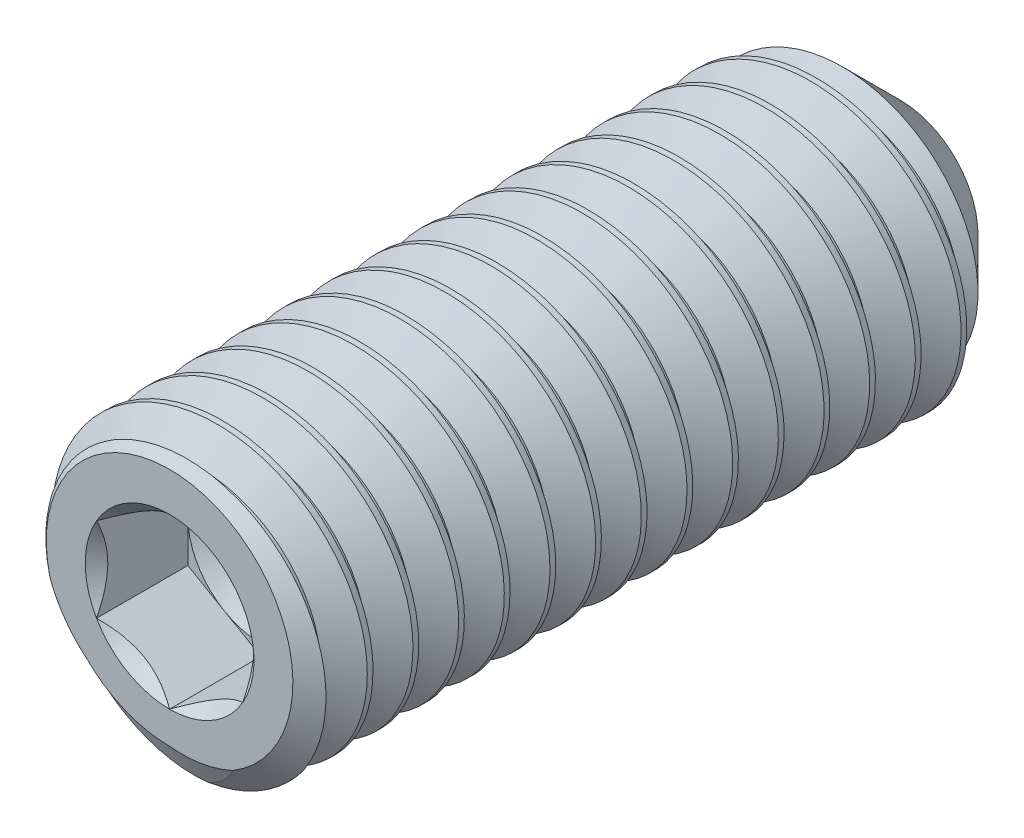
from build123d import *

# Parameters (mm, degrees)
CUT_EXTRUDE1_DEPTH = 2.5
CUT_SWEEP1_PITCH   = 1.25


with BuildPart() as part:
    # Sketch11 → Revolve1 (revolve)
    with BuildSketch(Plane(origin=(0, 0, 0), x_dir=(0, 0, -1), z_dir=(1, 0, 0)), mode=Mode.PRIVATE) as revolve1_sk:
        Polygon((-10, 0), (-10, 3.375), (-9.562370289, 4), (8.125, 4), (10, 2.125), (8.723171185, 0), align=None)
    revolve(revolve1_sk.sketch.rotate(Axis((0, 0, -8.723171185), (0, 0, -1)), 180), axis=Axis((0, 0, -8.723171185), (0, 0, -1)))

    # Sketch2 → Cut-Extrude1 (cut)
    with BuildSketch(Plane.XY.offset(10)):
        Polygon((0, 2.309401077), (-2, 1.154700538), (-2, -1.154700538), (0, -2.309401077), (2, -1.154700538), (2, 1.154700538), align=None)
    extrude(amount=-CUT_EXTRUDE1_DEPTH, mode=Mode.SUBTRACT)

    # Cut-Extrude2 cone 1 section (through the dimple's axis) → Cut-Extrude2 (revolve, cut)
    with BuildSketch(Plane(origin=(0, 0, 10), x_dir=(0, -1, 0), z_dir=(1, 0, 0))):
        Polygon((0, 0), (2.309401077, 0), (0, 2.309401077), align=None)
    revolve(axis=Axis((0, 0, 10), (0, 0, -1)), mode=Mode.SUBTRACT)

    # Cut-Extrude3 cone 1 section (through the dimple's axis) → Cut-Extrude3 (revolve, cut)
    with BuildSketch(Plane(origin=(0, 0, 7.5), x_dir=(0, -1, 0), z_dir=(1, 0, 0))):
        Polygon((0, 0), (2, 0), (0, 1.154700538), align=None)
    revolve(axis=Axis((0, 0, 7.5), (0, 0, -1)), mode=Mode.SUBTRACT)

    # Cut-Sweep1: the profile of Sketch6 screwed along a right-hand helix of 17.6 turns, 8 arcs to a turn; built about Z, then put on its axis
    cut_sweep1_z = Axis((0, 0, 0), (0, 0, 1))
    cut_sweep1_corners = [(3.188101184, 0, -0.46875), (4.067658235, 0, 0.0390625), (4.067658235, 0, -1.1328125), (3.188101184, 0, -0.625)]
    with BuildLine(mode=Mode.PRIVATE) as cut_sweep1_profile:
        Line(cut_sweep1_corners[0], cut_sweep1_corners[1])
        Line(cut_sweep1_corners[1], cut_sweep1_corners[2])
        Line(cut_sweep1_corners[2], cut_sweep1_corners[3])
        Line(cut_sweep1_corners[3], cut_sweep1_corners[0])
    cut_sweep1_cap = Face(cut_sweep1_profile.wire())
    cut_sweep1_turn_angles = [0, 22.5, 45, 67.5, 90, 112.5, 135, 157.5, 180, 202.5, 225, 247.5, 270, 292.5, 315, 337.5, 360]
    cut_sweep1_turn_weights = [1, 0.9238795325112867, 1, 0.9238795325112867, 1, 0.9238795325112867, 1, 0.9238795325112867, 1, 0.9238795325112867, 1, 0.9238795325112867, 1, 0.9238795325112867, 1, 0.9238795325112867, 1]
    cut_sweep1_turn_rails = [Edge.make_bspline([Vector(p[0], p[1], 0).rotate(cut_sweep1_z, cut_sweep1_turn_angles[k]) / cut_sweep1_turn_weights[k] + Vector(0, 0, p[2] + CUT_SWEEP1_PITCH * cut_sweep1_turn_angles[k] / 360) for k in range(17)], [0, 0, 0, 1, 1, 2, 2, 3, 3, 4, 4, 5, 5, 6, 6, 7, 7, 8, 8, 8], 2, cut_sweep1_turn_weights) for p in cut_sweep1_corners]
    cut_sweep1_turn_sides = [Face.make_surface_from_curves(cut_sweep1_turn_rails[p[0]], cut_sweep1_turn_rails[p[1]]) for p in [(0, 1), (1, 2), (2, 3), (3, 0)]]
    cut_sweep1_last_angles = [6120, 6142.5, 6165, 6187.5, 6210, 6232.5, 6255, 6277.5, 6300, 6318, 6336]
    cut_sweep1_last_weights = [1, 0.9238795325112867, 1, 0.9238795325112867, 1, 0.9238795325112867, 1, 0.9238795325112867, 1, 0.9510565162951389, 1]
    cut_sweep1_last_rails = [Edge.make_bspline([Vector(p[0], p[1], 0).rotate(cut_sweep1_z, cut_sweep1_last_angles[k]) / cut_sweep1_last_weights[k] + Vector(0, 0, p[2] + CUT_SWEEP1_PITCH * cut_sweep1_last_angles[k] / 360) for k in range(11)], [0, 0, 0, 1, 1, 2, 2, 3, 3, 4, 4, 5, 5, 5], 2, cut_sweep1_last_weights) for p in cut_sweep1_corners]
    cut_sweep1_last_sides = [Face.make_surface_from_curves(cut_sweep1_last_rails[p[0]], cut_sweep1_last_rails[p[1]]) for p in [(0, 1), (1, 2), (2, 3), (3, 0)]]
    cut_sweep1 = Plane(origin=(0, 0, -10), x_dir=(0, 1, 0), z_dir=(0, 0, 1)) * Solid(Shell([*[p.moved(Location((0, 0, CUT_SWEEP1_PITCH * i))) for i in range(17) for p in cut_sweep1_turn_sides], *cut_sweep1_last_sides, cut_sweep1_cap, cut_sweep1_cap.rotate(cut_sweep1_z, 6336).moved(Location((0, 0, CUT_SWEEP1_PITCH * 6336 / 360)))]))
    add(cut_sweep1, mode=Mode.SUBTRACT)


solid = part.part
